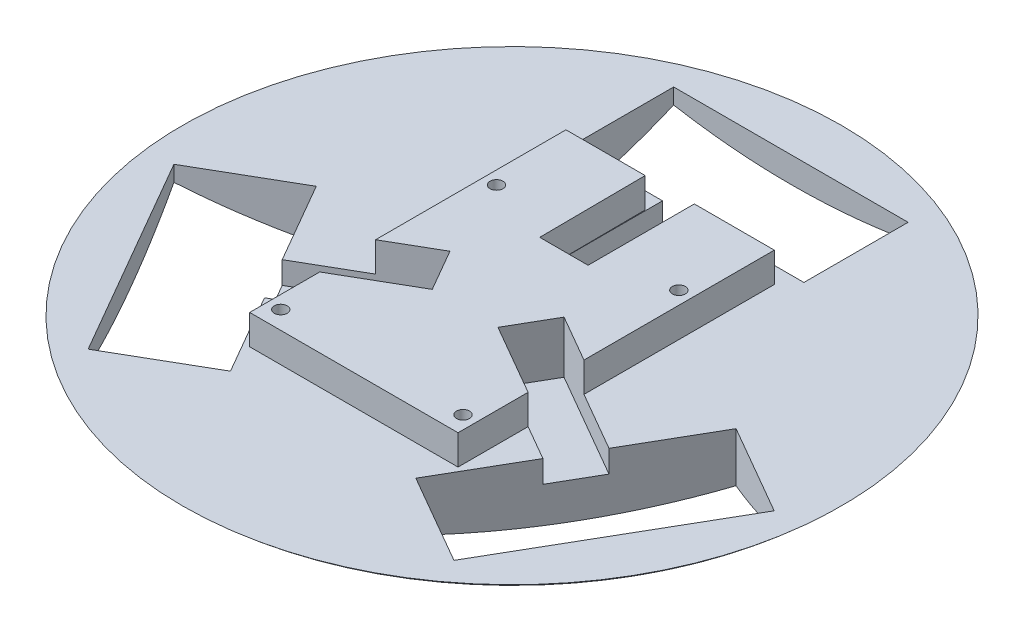
from build123d import *

# Parameters (mm, degrees)
SKETCH2_W           = 63
SKETCH2_H           = 28
CUT_EXTRUDE1_DEPTH  = 40
SKETCH4_W           = 13
SKETCH4_H           = 33
CUT_EXTRUDE2_DEPTH  = 6
SKETCH5_R           = 1.75
BOSS_EXTRUDE1_DEPTH = 8


with BuildPart() as part:
    # Sketch3 → Revolve1 (revolve)
    with BuildSketch(Plane(origin=(0, 0, 0), x_dir=(0, 0, -1), z_dir=(1, 0, 0))):
        with BuildLine():
            Line((0, 20), (0, 0))
            ThreePointArc((0, 0), (43.440585665, 3.508757487), (84.753971762, 17.38679738))
            ThreePointArc((84.753971762, 17.38679738), (86.762776598, 18.545504508), (88.56897203, 20))
            Line((88.56897203, 20), (0, 20))
        make_face()
    revolve(axis=Axis((0, 20, 0), (0, -1, 0)))

    # Sketch2 → Cut-Extrude1 (cut)
    with BuildSketch(Plane(origin=(0, 0, 0), x_dir=(1, 0, 0), z_dir=(0, 1, 0))):
        with Locations((0, 60.949465814)):
            Rectangle(SKETCH2_W, SKETCH2_H)
        Polygon((80.658141395, -10.194932688), (49.158141395, -64.754533126), (24.909430089, -50.754533126), (56.409430089, 3.805067312), align=None)
        Polygon((-49.158141395, -64.754533126), (-80.658141395, -10.194932688), (-56.409430089, 3.805067312), (-24.909430089, -50.754533126), align=None)
    extrude(amount=CUT_EXTRUDE1_DEPTH, mode=Mode.SUBTRACT)

    # Sketch4 → Cut-Extrude2 (cut)
    with BuildSketch(Plane(origin=(0, 20, 0), x_dir=(1, 0, 0), z_dir=(0, 1, 0))):
        with Locations((0, 30.449465814)):
            Rectangle(SKETCH4_W, SKETCH4_H)
        Polygon((37.409430089, -29.103898031), (43.909430089, -17.845567782), (15.330591764, -1.345567782), (8.830591764, -12.603898031), align=None)
        Polygon((-43.909430089, -17.845567782), (-37.409430089, -29.103898031), (-8.830591764, -12.603898031), (-15.330591764, -1.345567782), align=None)
    extrude(amount=-CUT_EXTRUDE2_DEPTH, mode=Mode.SUBTRACT)

    # Sketch5 → Boss-Extrude1 (add)
    with BuildSketch(Plane(origin=(0, 20, 0), x_dir=(1, 0, 0), z_dir=(0, 1, 0))):
        Polygon((-28, -23.671361037), (-8.830591764, -12.603898031), (-15.330591764, -1.345567782), (-28, -8.660254038), (-28, 42.5), (-6.711328351, 42.5), (-6.5, 13.949465814), (6.5, 13.949465814), (6.5, 42.5), (28, 42.5), (28, -8.660254038), (15.330591764, -1.345567782), (8.830591764, -12.603898031), (28, -23.671361037), (28, -42.5), (-28, -42.5), align=None)
        with Locations((-24.5, -37.660254038)):
            Circle(SKETCH5_R, mode=Mode.SUBTRACT)
        with Locations((24.5, -37.660254038)):
            Circle(SKETCH5_R, mode=Mode.SUBTRACT)
        with Locations((24.5, 20.339745962)):
            Circle(SKETCH5_R, mode=Mode.SUBTRACT)
        with Locations((-24.5, 20.339745962)):
            Circle(SKETCH5_R, mode=Mode.SUBTRACT)
    extrude(amount=BOSS_EXTRUDE1_DEPTH)


solid = part.part
